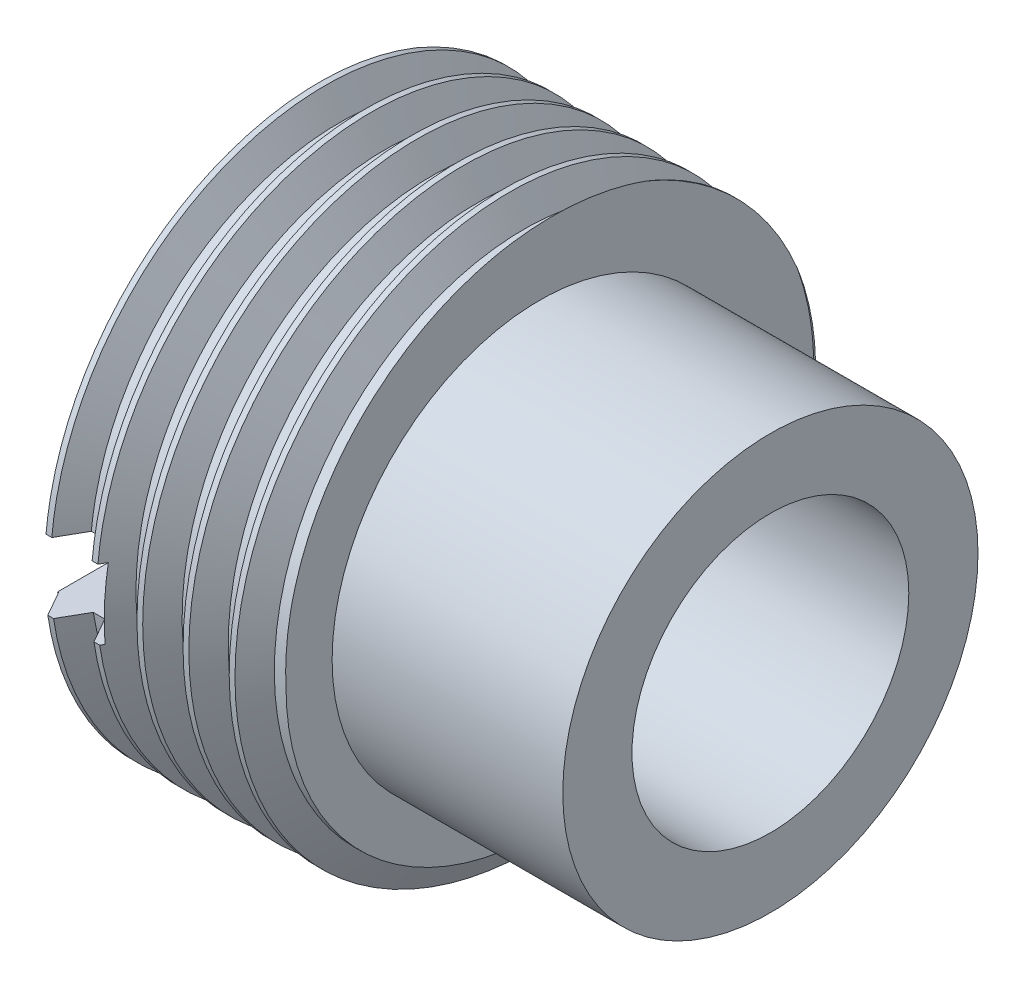
from build123d import *

# Parameters (mm, degrees)
THREAD1_PITCH                = 2
THREAD1_FROM                 = 1
THREAD1_TO                   = 11
CUT_EXTRUDE_THIN1_DEPTH      = 20.798362402
CUT_EXTRUDE_THIN1_DEPTH_BACK = 20.798362402
SKETCH2_W                    = 3
SKETCH2_H                    = 3


with BuildPart() as part:
    # Sketch1 → Revolve1 (revolve)
    with BuildSketch(Plane.XY, mode=Mode.PRIVATE) as revolve1_sk:
        Polygon((10, 6), (-10, 6), (-10, 11), (0, 11), (0, 9), (10, 9), align=None)
    revolve(revolve1_sk.sketch.rotate(Axis((10, 0, 0), (-1, 0, 0)), 90), axis=Axis((10, 0, 0), (-1, 0, 0)))

    # Thread1: arcs per turn and ends read off the stored shape
    # Thread1: the profile of Thread Profile1 profile screwed along a right-hand helix through 6 turns, 10 arcs to a turn; built about Z, then put on its axis
    thread1_z = Axis((0, 0, 0), (0, 0, 1))
    thread1_corners = [(10.9997, 0, -0.000173205), (12.08253175, 0, 0.624999997), (12.08253175, 0, 0.874999997), (10.9997, 0, 1.5001732)]
    with BuildLine(mode=Mode.PRIVATE) as thread1_profile:
        Line(thread1_corners[0], thread1_corners[1])
        Line(thread1_corners[1], thread1_corners[2])
        Line(thread1_corners[2], thread1_corners[3])
        Line(thread1_corners[3], thread1_corners[0])
    thread1_cap = Face(thread1_profile.wire())
    thread1_turn_angles = [0, 18, 36, 54, 72, 90, 108, 126, 144, 162, 180, 198, 216, 234, 252, 270, 288, 306, 324, 342, 360]
    thread1_turn_weights = [1, 0.9510565162951535, 1, 0.9510565162951535, 1, 0.9510565162951535, 1, 0.9510565162951535, 1, 0.9510565162951535, 1, 0.9510565162951535, 1, 0.9510565162951535, 1, 0.9510565162951535, 1, 0.9510565162951535, 1, 0.9510565162951535, 1]
    thread1_turn_rails = [Edge.make_bspline([Vector(p[0], p[1], 0).rotate(thread1_z, thread1_turn_angles[k]) / thread1_turn_weights[k] + Vector(0, 0, p[2] + THREAD1_PITCH * thread1_turn_angles[k] / 360) for k in range(21)], [0, 0, 0, 1, 1, 2, 2, 3, 3, 4, 4, 5, 5, 6, 6, 7, 7, 8, 8, 9, 9, 10, 10, 10], 2, thread1_turn_weights) for p in thread1_corners]
    thread1_turn_sides = [Face.make_surface_from_curves(thread1_turn_rails[p[0]], thread1_turn_rails[p[1]]) for p in [(0, 1), (1, 2), (2, 3), (3, 0)]]
    thread1 = Plane(origin=(-11, 0, 0), x_dir=(0, 0, -1), z_dir=(1, 0, 0)) * split(split(Solid(Shell([*[p.moved(Location((0, 0, THREAD1_PITCH * i))) for i in range(6) for p in thread1_turn_sides], thread1_cap, thread1_cap.rotate(thread1_z, 2160).moved(Location((0, 0, THREAD1_PITCH * 2160 / 360)))])), bisect_by=Plane.XY.offset(THREAD1_FROM), keep=Keep.TOP, mode=Mode.PRIVATE), bisect_by=Plane.XY.offset(THREAD1_TO), keep=Keep.BOTTOM, mode=Mode.PRIVATE)
    add(thread1)

    # Sketch2 → Cut-Extrude-Thin1 (cut, two sides: drawn at the far end of the back side and taken through both)
    with BuildSketch(Plane.XY.offset(-CUT_EXTRUDE_THIN1_DEPTH_BACK)):
        with Locations((-8.5, 0)):
            Rectangle(SKETCH2_W, SKETCH2_H)
    extrude(amount=CUT_EXTRUDE_THIN1_DEPTH + CUT_EXTRUDE_THIN1_DEPTH_BACK, mode=Mode.SUBTRACT)


solid = part.part
